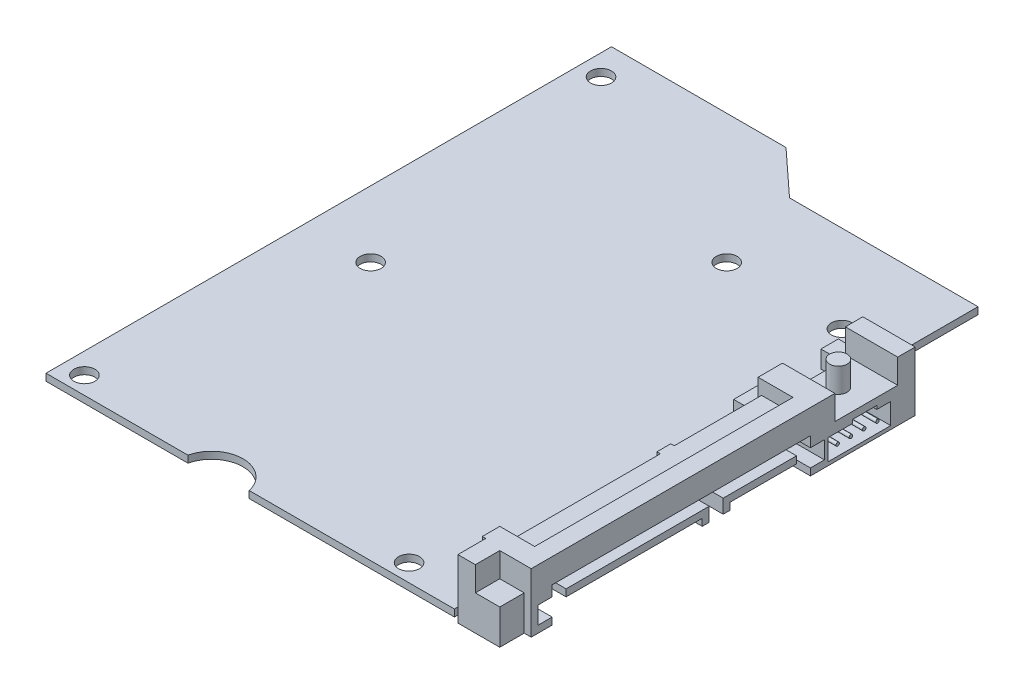
from build123d import *

# Parameters (mm, degrees)
EXTRUDE_1_DEPTH                    = 1
EXTRUDE_2_DEPTH                    = 0.5
EXTRUDE_3_DEPTH                    = 8.5
CUT_EXTRUDE_1_REACH                = 103.73
SKETCH_5_W                         = 3.5
SKETCH_5_H                         = 4.5
SKETCH_6_W                         = 7
SKETCH_6_H                         = 9
SKETCH_6_W_2                       = 4.5
SKETCH_6_H_2                       = 3.5
CUT_EXTRUDE_2_DEPTH                = 3.5
SKETCH_7_R                         = 1.25
EXTRUDE_5_DEPTH                    = 3.5
SKETCH_10_W                        = 5
SKETCH_10_H                        = 37
CUT_EXTRUDE_3_DEPTH                = 2
SKETCH_11_W                        = 5
SKETCH_11_H                        = 37
CUT_EXTRUDE_4_DEPTH                = 5
SKETCH_12_W                        = 3.5
SKETCH_12_H                        = 5
CUT_EXTRUDE_5_DEPTH                = 1
SKETCH_13_W                        = 3
SKETCH_13_H                        = 2.5
CUT_EXTRUDE_6_DEPTH                = 8
CUT_EXTRUDE_7_DEPTH                = 5
SKETCH_15_R                        = 0.25
EXTRUDE_6_DEPTH                    = 5
PATTERN_LINEAR_1_COUNT             = 4
PATTERN_LINEAR_1_PITCH             = 1.9
EXTRUDE_7_DEPTH                    = 5
SKETCH_17_R                        = 1.5
CUT_EXTRUDE_8_DEPTH                = 5
SKETCH_18_R                        = 4.5
CUT_EXTRUDE_9_DEPTH                = 105.718670733
SKETCH_19_W                        = 4.5
SKETCH_19_H                        = 1
EXTRUDE_8_DEPTH                    = 0.1
CHAMFER_1_SIZE                     = 0.1
PATTERN_LINEAR_3_COUNT             = 15
PATTERN_LINEAR_3_PITCH             = 1.3
CHAMFER_1_OF_PATTERN_LINEAR_3_SIZE = 0.1
SKETCH_20_W                        = 4.5
SKETCH_20_H                        = 1
EXTRUDE_9_DEPTH                    = 0.1
CHAMFER_2_SIZE                     = 0.1
PATTERN_LINEAR_4_COUNT             = 7
PATTERN_LINEAR_4_PITCH             = 1.3
CHAMFER_2_OF_PATTERN_LINEAR_4_SIZE = 0.1


with BuildPart() as part:
    # 草图1 → 凸台-拉伸1 (new body)
    with BuildSketch(Plane(origin=(0, 0, 0), x_dir=(1, 0, 0), z_dir=(0, 1, 0))):
        Polygon((25, 81), (31.5, 75), (58.5, 75), (58.5, 0), (0, 0), (0, 81), align=None)
    extrude(amount=EXTRUDE_1_DEPTH)

    # 草图2 → 凸台-拉伸2 (add)
    with BuildSketch(Plane.XZ):
        Polygon((59, -4), (55, -4), (55, -8), (59, -8), (59, -29), (57.5, -29), (57.5, -31), (59, -31), (59, -43.5), (55, -43.5), (55, -47), (59, -47), (59, -56), (55, -56), (55, -58.5), (66, -58.5), (66, 0), (59, 0), align=None)
    extrude(amount=EXTRUDE_2_DEPTH)

    # 草图3 → 凸台-拉伸3 (add)
    with BuildSketch(Plane.XZ.offset(0.5)):
        Polygon((66, 0), (59, 0), (59, -4), (55, -4), (55, -8), (59, -8), (59, -29), (57.5, -29), (57.5, -31), (59, -31), (59, -43.5), (55, -43.5), (55, -47), (59, -47), (59, -56), (55, -56), (55, -58.5), (66, -58.5), align=None)
    extrude(amount=-EXTRUDE_3_DEPTH)

    # 切除-拉伸1: up to this face of the body (flat: up to its plane)
    cut_extrude_1_end = Plane(part.part.faces().sort_by_distance((60.645833333, 3.876388889, -58.5))[0])
    # 草图5 → 切除-拉伸1 (cut, up to the picked face)
    with BuildSketch(Plane.XY.offset(-4), mode=Mode.PRIVATE) as cut_extrude_1_sk1:
        with Locations((56.75, 5.75)):
            Rectangle(SKETCH_5_W, SKETCH_5_H)
    cut_extrude_1_tool1 = split(extrude(cut_extrude_1_sk1.sketch, amount=-CUT_EXTRUDE_1_REACH, mode=Mode.PRIVATE), bisect_by=cut_extrude_1_end, keep=Keep.BOTH, mode=Mode.PRIVATE)
    add(cut_extrude_1_tool1.solids().sort_by(Axis((56.75, 5.75, -4), (0, 0, -1)))[0], mode=Mode.SUBTRACT)

    # 草图6 → 切除-拉伸2 (cut)
    with BuildSketch(Plane(origin=(0, 8, 0), x_dir=(1, 0, 0), z_dir=(0, 1, 0))):
        with Locations((62.5, 51.5)):
            Rectangle(SKETCH_6_W, SKETCH_6_H)
        with Locations((63.75, 1.75)):
            Rectangle(SKETCH_6_W_2, SKETCH_6_H_2)
    extrude(amount=-CUT_EXTRUDE_2_DEPTH, mode=Mode.SUBTRACT)

    # 草图7 → 凸台-拉伸5 (add)
    with BuildSketch(Plane(origin=(0, 4.5, 0), x_dir=(1, 0, 0), z_dir=(0, 1, 0))):
        with Locations(Location((62, 51.5, 0), (0, 0, 90))):
            Circle(SKETCH_7_R)
    extrude(amount=EXTRUDE_5_DEPTH)

    # 草图10 → 切除-拉伸3 (cut)
    with BuildSketch(Plane(origin=(0, 8, 0), x_dir=(1, 0, 0), z_dir=(0, 1, 0))):
        with Locations((61, 25)):
            Rectangle(SKETCH_10_W, SKETCH_10_H)
    extrude(amount=-CUT_EXTRUDE_3_DEPTH, mode=Mode.SUBTRACT)

    # 草图11 → 切除-拉伸4 (cut)
    with BuildSketch(Plane.XZ.offset(0.5)):
        with Locations((63.5, -25)):
            Rectangle(SKETCH_11_W, SKETCH_11_H)
    extrude(amount=-CUT_EXTRUDE_4_DEPTH, mode=Mode.SUBTRACT)

    # 草图12 → 切除-拉伸5 (cut)
    with BuildSketch(Plane(origin=(66, 0, 0), x_dir=(0, 0, -1), z_dir=(1, 0, 0))):
        with Locations((1.75, 2)):
            Rectangle(SKETCH_12_W, SKETCH_12_H)
    extrude(amount=-CUT_EXTRUDE_5_DEPTH, mode=Mode.SUBTRACT)

    # 草图13 → 切除-拉伸6 (cut)
    with BuildSketch(Plane(origin=(66, 0, 0), x_dir=(0, 0, -1), z_dir=(1, 0, 0))):
        with Locations((6, 1.75)):
            Rectangle(SKETCH_13_W, SKETCH_13_H)
        with Locations((44, 1.75)):
            Rectangle(SKETCH_13_W, SKETCH_13_H)
    extrude(amount=-CUT_EXTRUDE_6_DEPTH, mode=Mode.SUBTRACT)

    # 草图14 → 切除-拉伸7 (cut)
    with BuildSketch(Plane(origin=(66, 0, 0), x_dir=(0, 0, -1), z_dir=(1, 0, 0))):
        Polygon((46, 3), (49.5, 3), (49.5, 3.5), (53, 3.5), (53, 3), (55, 3), (55, 0), (46, 0), align=None)
    extrude(amount=-CUT_EXTRUDE_7_DEPTH, mode=Mode.SUBTRACT)

    # 草图15 → 凸台-拉伸6 (add)
    with BuildSketch(Plane(origin=(61, 0, 0), x_dir=(0, 0, -1), z_dir=(1, 0, 0))):
        with Locations(Location((47.4, 1.5, 0), (0, 0, 180))):
            Circle(SKETCH_15_R)
    extrude_6 = extrude(amount=EXTRUDE_6_DEPTH)

    # 阵列(线性)1: 凸台-拉伸6 ×4
    with Locations(*[(0, 0, -i * PATTERN_LINEAR_1_PITCH) for i in range(1, PATTERN_LINEAR_1_COUNT)]):
        add(extrude_6)

    # 草图16 → 凸台-拉伸7 (add)
    with BuildSketch(Plane(origin=(61, 0, 0), x_dir=(0, 0, -1), z_dir=(1, 0, 0))):
        Polygon((8.5, 2), (8.5, 3), (29, 3), (29, 1), (28, 1), (28, 2), align=None)
        Polygon((31, 1), (31, 3), (41.5, 3), (41.5, 2), (32, 2), (32, 1), align=None)
    extrude(amount=EXTRUDE_7_DEPTH)

    # 草图17 → 切除-拉伸8 (cut)
    with BuildSketch(Plane(origin=(0, 1, 0), x_dir=(1, 0, 0), z_dir=(0, 1, 0))):
        with Locations(Location((3, 76.5, 0), (0, 0, 270))):
            Circle(SKETCH_17_R)
        with Locations(Location((35, 62.5, 0), (0, 0, 270))):
            Circle(SKETCH_17_R)
        with Locations(Location((51.5, 62.5, 0), (0, 0, 270))):
            Circle(SKETCH_17_R)
        with Locations(Location((3, 2.5, 0), (0, 0, 270))):
            Circle(SKETCH_17_R)
        with Locations(Location((9.5, 37, 0), (0, 0, 270))):
            Circle(SKETCH_17_R)
        with Locations(Location((49.5, 2.5, 0), (0, 0, 270))):
            Circle(SKETCH_17_R)
    extrude(amount=-CUT_EXTRUDE_8_DEPTH, mode=Mode.SUBTRACT)

    # 草图18 → 切除-拉伸9 (cut, through all)
    with BuildSketch(Plane(origin=(0, 1, 0), x_dir=(1, 0, 0), z_dir=(0, 1, 0))):
        with Locations((24.72, -1)):
            Circle(SKETCH_18_R)
    extrude(amount=-CUT_EXTRUDE_9_DEPTH, mode=Mode.SUBTRACT)

    # 草图19 → 凸台-拉伸8 (add)
    with BuildSketch(Plane.XZ.offset(-2)):
        with Locations((63.25, -9.1)):
            Rectangle(SKETCH_19_W, SKETCH_19_H)
    extrude_8 = extrude(amount=EXTRUDE_8_DEPTH)

    # 倒角1
    chamfer_1_edges = [part.edges().sort_by_distance(p)[0] for p in [
        (65.5, 1.9, -9.1),
    ]]
    chamfer(chamfer_1_edges, length=CHAMFER_1_SIZE - 0.0001)  # a hair under: the kernel refuses the full size

    # 阵列(线性)3: 凸台-拉伸8 ×15
    with Locations(*[(0, 0, -i * PATTERN_LINEAR_3_PITCH) for i in range(1, PATTERN_LINEAR_3_COUNT)]):
        add(extrude_8)

    # 倒角1 of 阵列(线性)3
    chamfer_1_of_pattern_linear_3_edges = [part.edges().sort_by_distance(p)[0] for p in [
        (65.5, 1.9, -10.4),
        (65.5, 1.9, -11.7),
        (65.5, 1.9, -13),
        (65.5, 1.9, -14.3),
        (65.5, 1.9, -15.6),
        (65.5, 1.9, -16.9),
        (65.5, 1.9, -18.2),
        (65.5, 1.9, -19.5),
        (65.5, 1.9, -20.8),
        (65.5, 1.9, -22.1),
        (65.5, 1.9, -23.4),
        (65.5, 1.9, -24.7),
        (65.5, 1.9, -26),
        (65.5, 1.9, -27.3),
    ]]
    chamfer(chamfer_1_of_pattern_linear_3_edges, length=CHAMFER_1_OF_PATTERN_LINEAR_3_SIZE - 0.0001)  # a hair under: the kernel refuses the full size

    # 草图20 → 凸台-拉伸9 (add)
    with BuildSketch(Plane.XZ.offset(-2)):
        with Locations((63.25, -40.6)):
            Rectangle(SKETCH_20_W, SKETCH_20_H)
    extrude_9 = extrude(amount=EXTRUDE_9_DEPTH)

    # 倒角2
    chamfer_2_edges = [part.edges().sort_by_distance(p)[0] for p in [
        (65.5, 1.9, -40.6),
    ]]
    chamfer(chamfer_2_edges, length=CHAMFER_2_SIZE - 0.0001)  # a hair under: the kernel refuses the full size

    # 阵列(线性)4: 凸台-拉伸9 ×7
    with Locations(*[(0, 0, i * PATTERN_LINEAR_4_PITCH) for i in range(1, PATTERN_LINEAR_4_COUNT)]):
        add(extrude_9)

    # 倒角2 of 阵列(线性)4
    chamfer_2_of_pattern_linear_4_edges = [part.edges().sort_by_distance(p)[0] for p in [
        (65.5, 1.9, -39.3),
        (65.5, 1.9, -38),
        (65.5, 1.9, -36.7),
        (65.5, 1.9, -35.4),
        (65.5, 1.9, -34.1),
        (65.5, 1.9, -32.8),
    ]]
    chamfer(chamfer_2_of_pattern_linear_4_edges, length=CHAMFER_2_OF_PATTERN_LINEAR_4_SIZE - 0.0001)  # a hair under: the kernel refuses the full size


solid = part.part
